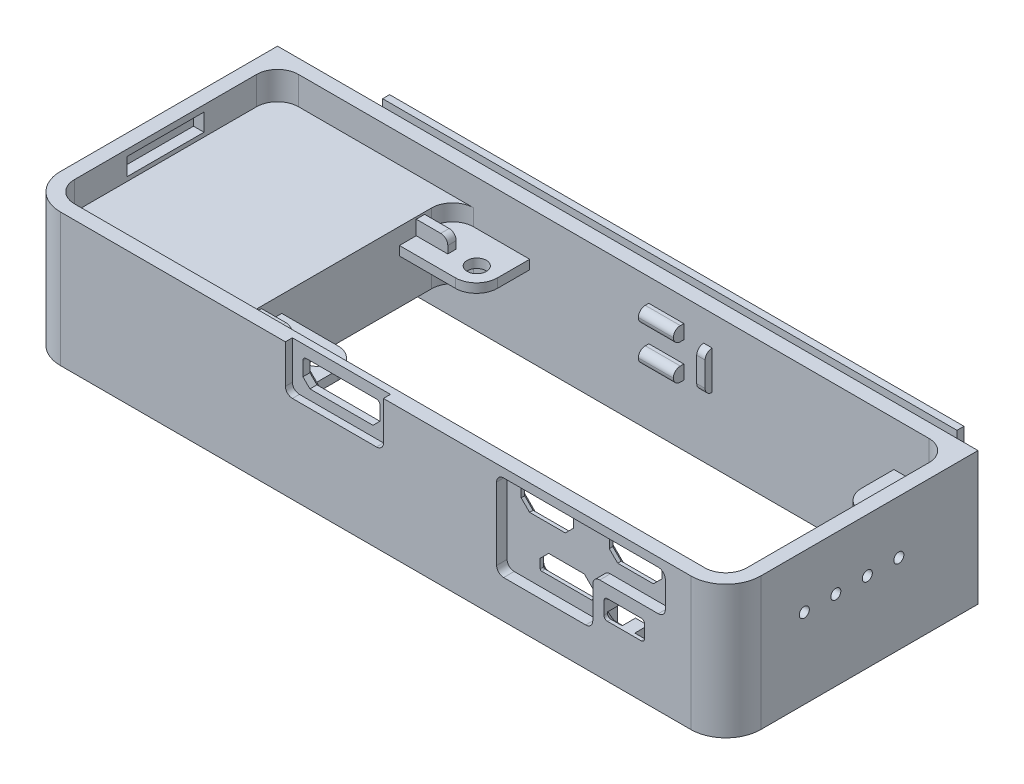
from build123d import *

# Parameters (mm, degrees)
EXTRUDE_1_DEPTH          = 7
EXTRUDE_1_DEPTH_BACK     = 12
CUT_EXTRUDE_2_DEPTH      = 45.635110658
CUT_EXTRUDE_2_DEPTH_BACK = 45.635110658
RIB_START                = -0.65
RIB_1_DEPTH              = 1.3
RIB_2_DEPTH              = 1.3
RIB_3_DEPTH              = 1.3
RIB_4_DEPTH              = 1.3
CUT_EXTRUDE_5_DEPTH      = 40
CUT_EXTRUDE_5_DEPTH_BACK = 40
SKETCH_18_R              = 1.375
SKETCH_41_W              = 14
SKETCH_41_H              = 6.5
CUT_EXTRUDE_14_DEPTH     = 1
EXTRUDE_14_DEPTH         = 0.5
CUT_EXTRUDE_18_DEPTH     = 1.5
SKETCH_50_W              = 7.5
SKETCH_50_H              = 2.7
CUT_EXTRUDE_19_DEPTH     = 2.9
SKETCH_51_W              = 5.8
SKETCH_51_H              = 2.8
CUT_EXTRUDE_20_DEPTH     = 2.4
FILLET_15_R              = 1
FILLET_16_R              = 1
FILLET_17_R              = 0.5
SKETCH_52_R              = 0.717792346
CUT_EXTRUDE_21_DEPTH     = 2
SKETCH_53_W              = 1.2
SKETCH_53_H              = 5.5
EXTRUDE_15_DEPTH         = 1
FILLET_20_R              = 1
SKETCH_55_W              = 1.2
SKETCH_55_H              = 5.5
EXTRUDE_17_DEPTH         = 1.4
SKETCH_54_W              = 1.2
SKETCH_54_H              = 5.5
EXTRUDE_18_DEPTH         = 4.5
FILLET_22_R              = 1
CHAMFER_2_SIZE           = 1.2
FILLET_23_R              = 0.2
SKETCH_58_W              = 11
SKETCH_58_H              = 2.5
CUT_EXTRUDE_23_DEPTH     = 1.4
CHAMFER_4_SIZE           = 1
SKETCH_59_W              = 11
SKETCH_59_H              = 2.5
CUT_EXTRUDE_24_DEPTH     = 1.4
CHAMFER_5_SIZE           = 1
SKETCH_60_W              = 7.5
SKETCH_60_H              = 5
CUT_EXTRUDE_25_DEPTH     = 0.5
EXTRUDE_20_DEPTH         = 0.9
EXTRUDE_20_DEPTH_BACK    = 0.5
SKETCH_56_W              = 0.6
SKETCH_56_H              = 1.5
SKETCH_56_W_2            = 1.8
SKETCH_56_H_2            = 0.767886541
SKETCH_56_W_3            = 1.5
SKETCH_56_H_3            = 1.54
CHAMFER_8_SIZE           = 1
SKETCH_63_W              = 1.2
SKETCH_63_H              = 5.5
EXTRUDE_21_DEPTH         = 4.5
FILLET_27_R              = 1
SKETCH_64_W              = 1.2
SKETCH_64_H              = 5.5
EXTRUDE_22_DEPTH         = 1.4
FILLET_28_R              = 1
SKETCH_65_W              = 1.2
SKETCH_65_H              = 5.5
EXTRUDE_23_DEPTH         = 0.9
CHAMFER_9_SIZE           = 0.5
FILLET_29_R              = 1
SKETCH_66_W              = 15
SKETCH_66_H              = 5
CUT_EXTRUDE_26_DEPTH     = 1.5
CHAMFER_10_SIZE          = 1
SKETCH_67_W              = 11
SKETCH_67_H              = 2.5
CUT_EXTRUDE_27_DEPTH     = 1.5
CHAMFER_11_SIZE          = 1
SKETCH_70_W              = 5
SKETCH_70_H              = 1.2
EXTRUDE_24_DEPTH         = 1.5
FILLET_31_R              = 1
SKETCH_71_W              = 5
SKETCH_71_H              = 2
EXTRUDE_25_DEPTH         = 1.5
FILLET_32_R              = 1
SKETCH_42_W              = 11
SKETCH_42_H              = 3.5
CUT_EXTRUDE_15_DEPTH     = 2.4
FILLET_33_R              = 1
SKETCH_74_W              = 16
SKETCH_74_H              = 7.4
EXTRUDE_26_DEPTH         = 0.5
CUT_EXTRUDE_29_REACH     = 56.445
SKETCH_46_W              = 11
SKETCH_46_H              = 3.5
CHAMFER_13_SIZE          = 1
FILLET_34_R              = 1
CHAMFER_14_SIZE          = 0.5
SKETCH_76_W              = 65
SKETCH_76_H              = 0.5
CUT_EXTRUDE_30_DEPTH     = 1.1
FILLET_35_R              = 1
FILLET_38_R              = 1.5
FILLET_39_R              = 0.5
ESQUISSE1_W              = 36
ESQUISSE1_H              = 19
BOSS_EXTRU_1_DEPTH       = 25
CONG_1_R                 = 5
ENL_V_MAT_EXTRU_1_DEPTH  = 4
ENL_V_START              = -5
ENL_V_MAT_EXTRU_2_DEPTH  = 5
ESQUISSE4_W              = 11
ESQUISSE4_H              = 2.5
ENL_V_MAT_EXTRU_3_DEPTH  = 1.5
CHANFREIN1_SIZE          = 1
ESQUISSE5_W              = 11
ESQUISSE5_H              = 2.5
ENL_V_MAT_EXTRU_4_DEPTH  = 1.5
CHANFREIN2_SIZE          = 1
ESQUISSE6_W              = 82
ESQUISSE6_H              = 7
BOSS_EXTRU_2_DEPTH       = 1
ESQUISSE7_W              = 82
ESQUISSE7_H              = 9
BOSS_EXTRU_3_DEPTH       = 1


with BuildPart() as part:
    # case 2 → 凸台-拉伸1 (new, two sides: drawn at the far end of the back side and taken through both)
    with BuildSketch(Plane(origin=(0, 0, 0), x_dir=(1, 0, 0), z_dir=(0, 1, 0)).offset(-EXTRUDE_1_DEPTH_BACK)):
        with BuildLine():
            Line((-39.042196447, 13), (-39.042196447, 18))
            Line((-39.042196447, 18), (-34.042196447, 18))
            Line((-34.042196447, 18), (30.957803553, 18))
            Line((30.957803553, 18), (35.957803553, 18))
            Line((35.957803553, 18), (35.957803553, 13))
            Line((35.957803553, 13), (35.957803553, -13))
            ThreePointArc((35.957803553, -13), (34.493337459, -16.535533906), (30.957803553, -18))
            Line((30.957803553, -18), (-34.042196447, -18))
            Line((-34.042196447, -18), (-39.042196447, -18))
            Line((-39.042196447, -18), (-39.042196447, -13))
            Line((-39.042196447, -13), (-39.042196447, 13))
        make_face()
    extrude(amount=EXTRUDE_1_DEPTH + EXTRUDE_1_DEPTH_BACK)

    # 草图13 → 切除-拉伸2 (cut, two sides: drawn at the far end of the back side and taken through both)
    with BuildSketch(Plane(origin=(0, 0, 0), x_dir=(1, 0, 0), z_dir=(0, 1, 0)).offset(-CUT_EXTRUDE_2_DEPTH_BACK)):
        with BuildLine():
            Line((-34.042196447, -16), (30.957803553, -16))
            ThreePointArc((30.957803553, -16), (33.079123896, -15.121320344), (33.957803553, -13))
            Line((33.957803553, -13), (33.957803553, 13))
            ThreePointArc((33.957803553, 13), (33.079123896, 15.121320344), (30.957803553, 16))
            Line((30.957803553, 16), (-34.042196447, 16))
            ThreePointArc((-34.042196447, 16), (-36.163516791, 15.121320344), (-37.042196447, 13))
            Line((-37.042196447, 13), (-37.042196447, -13))
            ThreePointArc((-37.042196447, -13), (-36.163516791, -15.121320344), (-34.042196447, -16))
        make_face()
    extrude(amount=CUT_EXTRUDE_2_DEPTH + CUT_EXTRUDE_2_DEPTH_BACK, mode=Mode.SUBTRACT)

    # 筋1: read off the stored shape, not the designer's step
    # 筋1 outline → 筋1 (add)
    with BuildSketch(Plane(origin=(0, 0, 0), x_dir=(1, 0, 0), z_dir=(0, 1, 0)).offset(RIB_START)):
        with BuildLine():
            Line((-37.042196447, 8.4), (-29.042196447, 8.4))
            ThreePointArc((-29.042196447, 8.4), (-26.920876103, 9.278679657), (-26.042196447, 11.4))
            Line((-26.042196447, 11.4), (-26.042196447, 16))
            Line((-26.042196447, 16), (-34.042196447, 16))
            ThreePointArc((-34.042196447, 16), (-36.163516791, 15.121320344), (-37.042196447, 13))
            Line((-37.042196447, 13), (-37.042196447, 8.4))
        make_face()
    extrude(amount=RIB_1_DEPTH)

    # 筋2: read off the stored shape, not the designer's step
    # 筋2 outline → 筋2 (add)
    with BuildSketch(Plane(origin=(0, 0, 0), x_dir=(1, 0, 0), z_dir=(0, 1, 0)).offset(RIB_START)):
        with BuildLine():
            Line((-34.042196447, -16), (-26.042196447, -16))
            Line((-26.042196447, -16), (-26.042196447, -11.4))
            ThreePointArc((-26.042196447, -11.4), (-26.920876103, -9.278679657), (-29.042196447, -8.4))
            Line((-29.042196447, -8.4), (-37.042196447, -8.4))
            Line((-37.042196447, -8.4), (-37.042196447, -13))
            ThreePointArc((-37.042196447, -13), (-36.163516791, -15.121320344), (-34.042196447, -16))
        make_face()
    extrude(amount=RIB_2_DEPTH)

    # 筋3: read off the stored shape, not the designer's step
    # 筋3 outline → 筋3 (add)
    with BuildSketch(Plane(origin=(0, 0, 0), x_dir=(1, 0, 0), z_dir=(0, 1, 0)).offset(RIB_START)):
        with BuildLine():
            ThreePointArc((25.957803553, 11.4), (26.836483209, 9.278679656), (28.957803553, 8.4))
            Line((28.957803553, 8.4), (33.957803553, 8.4))
            Line((33.957803553, 8.4), (33.957803553, 13))
            ThreePointArc((33.957803553, 13), (33.079123897, 15.121320343), (30.957803553, 16))
            Line((30.957803553, 16), (25.957803553, 16))
            Line((25.957803553, 16), (25.957803553, 11.4))
        make_face()
    extrude(amount=RIB_3_DEPTH)

    # 筋4: read off the stored shape, not the designer's step
    # 筋4 outline → 筋4 (add)
    with BuildSketch(Plane(origin=(0, 0, 0), x_dir=(1, 0, 0), z_dir=(0, 1, 0)).offset(RIB_START)):
        with BuildLine():
            Line((33.957803553, -13), (33.957803553, -8.4))
            Line((33.957803553, -8.4), (28.957803553, -8.4))
            ThreePointArc((28.957803553, -8.4), (26.836483209, -9.278679656), (25.957803553, -11.4))
            Line((25.957803553, -11.4), (25.957803553, -16))
            Line((25.957803553, -16), (30.957803553, -16))
            ThreePointArc((30.957803553, -16), (33.079123897, -15.121320343), (33.957803553, -13))
        make_face()
    extrude(amount=RIB_4_DEPTH)

    # 草图18 → 切除-拉伸5 (cut, two sides: drawn at the far end of the back side and taken through both)
    with BuildSketch(Plane(origin=(0, 0, 0), x_dir=(1, 0, 0), z_dir=(0, 1, 0)).offset(-CUT_EXTRUDE_5_DEPTH_BACK)):
        with Locations(Location((-29, 11.4, 0), (0, 0, 270))):
            Circle(SKETCH_18_R)
        with Locations(Location((-29, -11.5, 0), (0, 0, 270))):
            Circle(SKETCH_18_R)
        with Locations(Location((29, 11.4, 0), (0, 0, 270))):
            Circle(SKETCH_18_R)
        with Locations(Location((29, -11.5, 0), (0, 0, 270))):
            Circle(SKETCH_18_R)
    extrude(amount=CUT_EXTRUDE_5_DEPTH + CUT_EXTRUDE_5_DEPTH_BACK, mode=Mode.SUBTRACT)

    # 草图41 → 切除-拉伸14 (cut)
    with BuildSketch(Plane.XY.offset(18)):
        with Locations((-19.922149827, 3.75)):
            Rectangle(SKETCH_41_W, SKETCH_41_H)
    extrude(amount=-CUT_EXTRUDE_14_DEPTH, mode=Mode.SUBTRACT)

    # 草图48 → 凸台-拉伸14 (add)
    with BuildSketch(Plane(origin=(0, 0, 16), x_dir=(-1, 0, 0), z_dir=(0, 0, -1))):
        Polygon((-2.234862183, -7.567886541), (-2.234862183, 6.748192542), (-28.313738428, 6.748192542), (-28.313738428, -1), (-17.957803553, -1), (-17.957803553, -7.567886541), align=None)
    extrude(amount=EXTRUDE_14_DEPTH)

    # 草图49 → 切除-拉伸18 (cut)
    with BuildSketch(Plane.XY.offset(18)):
        Polygon((27.313738428, 5.748192542), (27.313738428, 0), (16.957803553, 0), (16.957803553, -6.567886541), (3.234862183, -6.567886541), (3.234862183, 5.748192542), align=None)
    extrude(amount=-CUT_EXTRUDE_18_DEPTH, mode=Mode.SUBTRACT)

    # 草图50 → 切除-拉伸19 (cut)
    with BuildSketch(Plane.XY.offset(18)):
        with Locations((21.563738428, 3.198192542)):
            Rectangle(SKETCH_50_W, SKETCH_50_H)
        with Locations((11.707803553, -3.217886541)):
            Rectangle(SKETCH_50_W, SKETCH_50_H)
        with Locations((8.984862183, 3.198192542)):
            Rectangle(SKETCH_50_W, SKETCH_50_H)
    extrude(amount=-CUT_EXTRUDE_19_DEPTH, mode=Mode.SUBTRACT)

    # 草图51 → 切除-拉伸20 (cut)
    with BuildSketch(Plane.XY.offset(18)):
        with Locations((21.457803553, -3.167886541)):
            Rectangle(SKETCH_51_W, SKETCH_51_H)
    extrude(amount=-CUT_EXTRUDE_20_DEPTH, mode=Mode.SUBTRACT)

    # 圆角15
    fillet_15_edges = [part.edges().sort_by_distance(p)[0] for p in [
        (3.234862183, 5.748192542, 17.25),
        (27.313738428, 5.748192542, 17.25),
        (27.313738428, 0, 17.25),
        (16.957803553, 0, 17.25),
        (16.957803553, -6.567886541, 17.25),
        (3.234862183, -6.567886541, 17.25),
    ]]
    fillet(fillet_15_edges, radius=FILLET_15_R)

    # 圆角16
    # the kernel refuses this fillet: 1 mm, written as the material it takes off along each edge
    with BuildSketch(Plane(origin=(2.234862183, -7.567886541, 16), x_dir=(0, 1, 0), z_dir=(0, 0, -1)), Plane(origin=(17.957803553, -7.567886541, 16), x_dir=(-1, 0, 0), z_dir=(0, 0, -1))) as fillet_16_piece_1:
        with BuildLine():
            CenterArc((FILLET_16_R, FILLET_16_R), FILLET_16_R, 180, 90)
            Line((0, FILLET_16_R), (-FILLET_16_R * 0.02, FILLET_16_R))
            Line((-FILLET_16_R * 0.02, FILLET_16_R), (-FILLET_16_R * 0.02, -FILLET_16_R * 0.02))
            Line((-FILLET_16_R * 0.02, -FILLET_16_R * 0.02), (FILLET_16_R, -FILLET_16_R * 0.02))
            Line((FILLET_16_R, -FILLET_16_R * 0.02), (FILLET_16_R, 0))
        make_face()
    extrude(amount=3, mode=Mode.SUBTRACT)
    with BuildSketch(Plane(origin=(28.313738428, -1, 16), x_dir=(0, 1, 0), z_dir=(0, 0, -1))) as fillet_16_piece_2:
        with BuildLine():
            CenterArc((1, -0.759934208), FILLET_16_R, 130.541601874, 49.458398126)
            Line((0, -0.759934208), (-0.02, -0.759934208))
            Line((-0.02, -0.759934208), (-0.02, 0))
            Line((-0.02, 0), (0, 0.02))
            ThreePointArc((0, 0.02), (0.175, 0.02), (0.337, 0.015198684))
            Line((0.337, 0.015198684), (0.35, 0))
        make_face()
    extrude(amount=2.399835519, mode=Mode.SUBTRACT)

    # 圆角17
    fillet_17_edges = [part.edges().sort_by_distance(p)[0] for p in [
        (18.557803553, -1.767886541, 17),
        (24.357803553, -1.767886541, 17),
        (24.357803553, -4.567886541, 17),
        (18.557803553, -4.567886541, 17),
    ]]
    fillet(fillet_17_edges, radius=FILLET_17_R)

    # 草图52 → 切除-拉伸21 (cut)
    with BuildSketch(Plane(origin=(35.957803553, 0, 0), x_dir=(0, 0, -1), z_dir=(1, 0, 0))):
        with Locations((-6.8, -0.597891307)):
            Circle(SKETCH_52_R)
        with Locations((-2.3, -0.597891307)):
            Circle(SKETCH_52_R)
        with Locations((2.2, -0.597891307)):
            Circle(SKETCH_52_R)
        with Locations((6.7, -0.597891307)):
            Circle(SKETCH_52_R)
    extrude(amount=-CUT_EXTRUDE_21_DEPTH, mode=Mode.SUBTRACT)

    # 草图53 → 凸台-拉伸15 (add)
    with BuildSketch(Plane.XY.offset(-16)):
        with Locations((-0.6, -0.05)):
            Rectangle(SKETCH_53_W, SKETCH_53_H)
    extrude(amount=EXTRUDE_15_DEPTH)

    # 圆角20
    fillet_20_edges = [part.edges().sort_by_distance(p)[0] for p in [
        (-0.6, -2.8, -15),
        (-0.6, 2.7, -15),
    ]]
    fillet(fillet_20_edges, radius=FILLET_20_R - 0.0001)  # a hair under: the kernel refuses the full size

    # 草图55 → 凸台-拉伸17 (add)
    with BuildSketch(Plane.ZY.offset(-33.957803553)):
        with Locations((-11.4, -0.05)):
            Rectangle(SKETCH_55_W, SKETCH_55_H)
    extrude(amount=EXTRUDE_17_DEPTH)

    # 草图54 → 凸台-拉伸18 (add)
    with BuildSketch(Plane(origin=(-37.042196447, 0, 0), x_dir=(0, 0, -1), z_dir=(1, 0, 0))):
        with Locations((11.4, -0.05)):
            Rectangle(SKETCH_54_W, SKETCH_54_H)
    extrude(amount=EXTRUDE_18_DEPTH)

    # 圆角22
    fillet_22_edges = [part.edges().sort_by_distance(p)[0] for p in [
        (32.557803553, -2.8, -11.4),
        (32.557803553, 2.7, -11.4),
        (-32.542196447, -2.8, -11.4),
        (-32.542196447, 2.7, -11.4),
    ]]
    fillet(fillet_22_edges, radius=FILLET_22_R)

    # 倒角2
    chamfer_2_edges = [part.edges().sort_by_distance(p)[0] for p in [
        (25.313738428, 1.848192542, 16),
        (17.813738428, 1.848192542, 16),
        (7.957803553, -1.867886541, 16),
        (15.457803553, -1.867886541, 16),
        (5.234862183, 1.848192542, 16),
        (12.734862183, 1.848192542, 16),
    ]]
    chamfer(chamfer_2_edges, length=CHAMFER_2_SIZE)

    # 圆角23
    fillet_23_edges = [part.edges().sort_by_distance(p)[0] for p in [
        (17.813738428, 4.548192542, 16),
        (25.313738428, 4.548192542, 16),
        (15.457803553, -4.567886541, 16),
        (7.957803553, -4.567886541, 16),
        (5.234862183, 4.548192542, 16),
        (12.734862183, 4.548192542, 16),
    ]]
    fillet(fillet_23_edges, radius=FILLET_23_R)

    # 草图58 → 切除-拉伸23 (cut)
    with BuildSketch(Plane.ZY.offset(-33.957803553)):
        with Locations((0, -9.85)):
            Rectangle(SKETCH_58_W, SKETCH_58_H)
    extrude(amount=-CUT_EXTRUDE_23_DEPTH, mode=Mode.SUBTRACT)

    # 倒角4
    chamfer_4_edges = [part.edges().sort_by_distance(p)[0] for p in [
        (35.357803553, -11.1, 0),
    ]]
    chamfer(chamfer_4_edges, length=CHAMFER_4_SIZE)

    # 草图59 → 切除-拉伸24 (cut)
    with BuildSketch(Plane(origin=(-37.042196447, 0, 0), x_dir=(0, 0, -1), z_dir=(1, 0, 0))):
        with Locations((2.5, 4.85)):
            Rectangle(SKETCH_59_W, SKETCH_59_H)
    extrude(amount=-CUT_EXTRUDE_24_DEPTH, mode=Mode.SUBTRACT)

    # 倒角5
    chamfer_5_edges = [part.edges().sort_by_distance(p)[0] for p in [
        (-38.442196447, 6.1, -2.5),
    ]]
    chamfer(chamfer_5_edges, length=CHAMFER_5_SIZE)

    # 草图60 → 切除-拉伸25 (cut)
    with BuildSketch(Plane(origin=(0, 0, 16), x_dir=(-1, 0, 0), z_dir=(0, 0, -1))):
        with Locations((-21.707803553, -3.5)):
            Rectangle(SKETCH_60_W, SKETCH_60_H)
    extrude(amount=-CUT_EXTRUDE_25_DEPTH, mode=Mode.SUBTRACT)

    # 草图56 → 凸台-拉伸20 (add, two sides: drawn at the far end of the back side and taken through both)
    with BuildSketch(Plane(origin=(0, 0, 16), x_dir=(-1, 0, 0), z_dir=(0, 0, -1)).offset(-EXTRUDE_20_DEPTH_BACK)):
        with Locations((-18.257803553, -3.15173139)):
            Rectangle(SKETCH_56_W, SKETCH_56_H)
        with Locations((-21.557803553, -1.383943271)):
            Rectangle(SKETCH_56_W_2, SKETCH_56_H_2)
        with Locations((-25.107803553, -3.15173139)):
            Rectangle(SKETCH_56_W_3, SKETCH_56_H)
        with Locations((-21.557803553, -5.337886541)):
            Rectangle(SKETCH_56_W_2, SKETCH_56_H_3)
    extrude(amount=EXTRUDE_20_DEPTH + EXTRUDE_20_DEPTH_BACK)

    # 倒角8
    # the kernel refuses this chamfer: 1 mm, written as the material it takes off along each edge
    with BuildSketch(Plane(origin=(19.057803553, -2.267886541, 16.5), x_dir=(-1, 0, 0), z_dir=(0, -1, 0))) as chamfer_8_piece_1_section:
        Polygon((0.5, -CHAMFER_8_SIZE), (0.5 + CHAMFER_8_SIZE, 0), (0.5, 0), align=None)
    chamfer_8_piece_1 = revolve(axis=Axis((19.057803553, -2.267886541, 16.5), (0, 0, -1)), revolution_arc=90, mode=Mode.PRIVATE)
    chamfer_8_piece_1 = split(chamfer_8_piece_1, bisect_by=Plane(origin=(17.957803553, -2.267886541, 16.5), z_dir=(1, 0, 0)), keep=Keep.TOP, mode=Mode.PRIVATE)
    chamfer_8_piece_1 = split(chamfer_8_piece_1, bisect_by=Plane(origin=(19.057803553, -1, 16.5), z_dir=(0, -1, 0)), keep=Keep.TOP, mode=Mode.PRIVATE)
    add(chamfer_8_piece_1, mode=Mode.SUBTRACT)
    with BuildSketch(Plane(origin=(24.357803553, -2.267886541, 16.5), x_dir=(0, 0, 1), z_dir=(0, -1, 0))) as chamfer_8_piece_2:
        Polygon((CHAMFER_8_SIZE, 0), (0, -CHAMFER_8_SIZE), (0, 0), align=None)
    extrude(amount=0.133844849, mode=Mode.SUBTRACT)
    with BuildSketch(Plane(origin=(23.857803553, -4.067886541, 16.5), x_dir=(1, 0, 0), z_dir=(0, 1, 0))) as chamfer_8_piece_3:
        Polygon((0.5, -CHAMFER_8_SIZE), (0.5 + CHAMFER_8_SIZE, 0), (0.5, 0), align=None)
    revolve(axis=Axis((23.857803553, -4.067886541, 16.5), (0, 0, -1)), revolution_arc=90, mode=Mode.SUBTRACT)
    with BuildSketch(Plane(origin=(23.857803553, -4.567886541, 16.5), x_dir=(0, 0, 1), z_dir=(-1, 0, 0))) as chamfer_8_piece_4:
        Polygon((CHAMFER_8_SIZE, 0), (0, -CHAMFER_8_SIZE), (0, 0), align=None)
    extrude(amount=1.4, mode=Mode.SUBTRACT)
    with BuildSketch(Plane(origin=(23.857803553, -4.567886541, 16.5), x_dir=(0, 0, 1), z_dir=(-1, 0, 0))) as chamfer_8_piece_5_section:
        Polygon((CHAMFER_8_SIZE, 0), (0, -CHAMFER_8_SIZE), (0, 0), align=None)
    chamfer_8_piece_5 = extrude(amount=3.971682988, mode=Mode.PRIVATE)
    chamfer_8_piece_5 = split(chamfer_8_piece_5, bisect_by=Plane(origin=(20.657803553, -4.567886541, 16.5), z_dir=(-1, 0, 0)), keep=Keep.TOP, mode=Mode.PRIVATE)
    add(chamfer_8_piece_5, mode=Mode.SUBTRACT)
    with BuildSketch(Plane(origin=(19.057803553, -4.067886541, 16.5), x_dir=(0, -1, 0), z_dir=(1, 0, 0))) as chamfer_8_piece_6_section:
        Polygon((0.5, -CHAMFER_8_SIZE), (0.5 + CHAMFER_8_SIZE, 0), (0.5, 0), align=None)
    chamfer_8_piece_6 = revolve(axis=Axis((19.057803553, -4.067886541, 16.5), (0, 0, -1)), revolution_arc=90, mode=Mode.PRIVATE)
    chamfer_8_piece_6 = split(chamfer_8_piece_6, bisect_by=Plane(origin=(17.957803553, -4.067886541, 16.5), z_dir=(1, 0, 0)), keep=Keep.TOP, mode=Mode.PRIVATE)
    add(chamfer_8_piece_6, mode=Mode.SUBTRACT)
    with BuildSketch(Plane(origin=(18.557803553, -4.067886541, 16.5), x_dir=(0, 0, 1), z_dir=(0, 1, 0))) as chamfer_8_piece_7_section:
        Polygon((CHAMFER_8_SIZE, 0), (0, -CHAMFER_8_SIZE), (0, 0), align=None)
    chamfer_8_piece_7 = extrude(amount=0.166155151, mode=Mode.PRIVATE)
    chamfer_8_piece_7 = split(chamfer_8_piece_7, bisect_by=Plane(origin=(17.957803553, -4.067886541, 16.5), z_dir=(1, 0, 0)), keep=Keep.TOP, mode=Mode.PRIVATE)
    add(chamfer_8_piece_7, mode=Mode.SUBTRACT)
    with BuildSketch(Plane(origin=(19.057803553, -1.767886541, 16.5), x_dir=(0, 0, 1), z_dir=(1, 0, 0))) as chamfer_8_piece_8_section:
        Polygon((CHAMFER_8_SIZE, 0), (0, -CHAMFER_8_SIZE), (0, 0), align=None)
    chamfer_8_piece_8 = extrude(amount=1.6, mode=Mode.PRIVATE)
    chamfer_8_piece_8 = split(chamfer_8_piece_8, bisect_by=Plane(origin=(19.057803553, -1, 16.5), z_dir=(0, -1, 0)), keep=Keep.TOP, mode=Mode.PRIVATE)
    add(chamfer_8_piece_8, mode=Mode.SUBTRACT)
    with BuildSketch(Plane(origin=(19.057803553, -1.767886541, 16.5), x_dir=(0, 0, 1), z_dir=(1, 0, 0))) as chamfer_8_piece_9_section:
        Polygon((CHAMFER_8_SIZE, 0), (0, -CHAMFER_8_SIZE), (0, 0), align=None)
    chamfer_8_piece_9 = extrude(amount=4.171682988, mode=Mode.PRIVATE)
    chamfer_8_piece_9 = split(chamfer_8_piece_9, bisect_by=Plane(origin=(19.057803553, -1, 16.5), z_dir=(0, -1, 0)), keep=Keep.TOP, mode=Mode.PRIVATE)
    chamfer_8_piece_9 = split(chamfer_8_piece_9, bisect_by=Plane(origin=(22.457803553, -1.767886541, 16.5), z_dir=(1, 0, 0)), keep=Keep.TOP, mode=Mode.PRIVATE)
    add(chamfer_8_piece_9, mode=Mode.SUBTRACT)
    with BuildSketch(Plane(origin=(23.857803553, -2.267886541, 16.5), x_dir=(0, 1, 0), z_dir=(-1, 0, 0))) as chamfer_8_piece_10_section:
        Polygon((0.5, -CHAMFER_8_SIZE), (0.5 + CHAMFER_8_SIZE, 0), (0.5, 0), align=None)
    chamfer_8_piece_10 = revolve(axis=Axis((23.857803553, -2.267886541, 16.5), (0, 0, -1)), revolution_arc=90, mode=Mode.PRIVATE)
    chamfer_8_piece_10 = split(chamfer_8_piece_10, bisect_by=Plane(origin=(23.857803553, -1, 16.5), z_dir=(0, -1, 0)), keep=Keep.TOP, mode=Mode.PRIVATE)
    add(chamfer_8_piece_10, mode=Mode.SUBTRACT)
    with BuildSketch(Plane(origin=(19.886120565, -1.767886541, 16.5), x_dir=(0, 0, 1), z_dir=(1, 0, 0))) as chamfer_8_piece_11_section:
        Polygon((CHAMFER_8_SIZE, 0), (0, -CHAMFER_8_SIZE), (0, 0), align=None)
    chamfer_8_piece_11 = extrude(amount=3.971682988, mode=Mode.PRIVATE)
    chamfer_8_piece_11 = split(chamfer_8_piece_11, bisect_by=Plane(origin=(19.886120565, -1, 16.5), z_dir=(0, -1, 0)), keep=Keep.TOP, mode=Mode.PRIVATE)
    chamfer_8_piece_11 = split(chamfer_8_piece_11, bisect_by=Plane(origin=(20.657803553, -1.767886541, 16.5), z_dir=(-1, 0, 0)), keep=Keep.TOP, mode=Mode.PRIVATE)
    add(chamfer_8_piece_11, mode=Mode.SUBTRACT)
    with BuildSketch(Plane(origin=(22.457803553, -1.767886541, 16.5), x_dir=(0, 0, 1), z_dir=(1, 0, 0))) as chamfer_8_piece_12_section:
        Polygon((CHAMFER_8_SIZE, 0), (0, -CHAMFER_8_SIZE), (0, 0), align=None)
    chamfer_8_piece_12 = extrude(amount=1.4, mode=Mode.PRIVATE)
    chamfer_8_piece_12 = split(chamfer_8_piece_12, bisect_by=Plane(origin=(22.457803553, -1, 16.5), z_dir=(0, -1, 0)), keep=Keep.TOP, mode=Mode.PRIVATE)
    add(chamfer_8_piece_12, mode=Mode.SUBTRACT)
    with BuildSketch(Plane(origin=(18.557803553, -2.40173139, 16.5), x_dir=(0, 0, 1), z_dir=(0, 1, 0))) as chamfer_8_piece_13_section:
        Polygon((CHAMFER_8_SIZE, 0), (0, -CHAMFER_8_SIZE), (0, 0), align=None)
    chamfer_8_piece_13 = extrude(amount=0.133844849, mode=Mode.PRIVATE)
    chamfer_8_piece_13 = split(chamfer_8_piece_13, bisect_by=Plane(origin=(17.957803553, -2.40173139, 16.5), z_dir=(1, 0, 0)), keep=Keep.TOP, mode=Mode.PRIVATE)
    add(chamfer_8_piece_13, mode=Mode.SUBTRACT)
    with BuildSketch(Plane(origin=(24.357803553, -3.90173139, 16.5), x_dir=(0, 0, 1), z_dir=(0, -1, 0))) as chamfer_8_piece_14:
        Polygon((CHAMFER_8_SIZE, 0), (0, -CHAMFER_8_SIZE), (0, 0), align=None)
    extrude(amount=0.166155151, mode=Mode.SUBTRACT)
    with BuildSketch(Plane(origin=(23.229486541, -4.567886541, 16.5), x_dir=(0, 0, 1), z_dir=(-1, 0, 0))) as chamfer_8_piece_15_section:
        Polygon((CHAMFER_8_SIZE, 0), (0, -CHAMFER_8_SIZE), (0, 0), align=None)
    chamfer_8_piece_15 = extrude(amount=4.171682988, mode=Mode.PRIVATE)
    chamfer_8_piece_15 = split(chamfer_8_piece_15, bisect_by=Plane(origin=(22.457803553, -4.567886541, 16.5), z_dir=(1, 0, 0)), keep=Keep.TOP, mode=Mode.PRIVATE)
    add(chamfer_8_piece_15, mode=Mode.SUBTRACT)
    with BuildSketch(Plane(origin=(20.657803553, -4.567886541, 16.5), x_dir=(0, 0, 1), z_dir=(-1, 0, 0))) as chamfer_8_piece_16:
        Polygon((CHAMFER_8_SIZE, 0), (0, -CHAMFER_8_SIZE), (0, 0), align=None)
    extrude(amount=1.6, mode=Mode.SUBTRACT)

    # 草图63 → 凸台-拉伸21 (add)
    with BuildSketch(Plane(origin=(-37.042196447, 0, 0), x_dir=(0, 0, -1), z_dir=(1, 0, 0))):
        with Locations((-11.9, -0.05)):
            Rectangle(SKETCH_63_W, SKETCH_63_H)
    extrude(amount=EXTRUDE_21_DEPTH)

    # 圆角27
    fillet_27_edges = [part.edges().sort_by_distance(p)[0] for p in [
        (-32.542196447, -2.8, 11.9),
        (-32.542196447, 2.7, 11.9),
    ]]
    fillet(fillet_27_edges, radius=FILLET_27_R)

    # 草图64 → 凸台-拉伸22 (add)
    with BuildSketch(Plane.ZY.offset(-33.957803553)):
        with Locations((11.9, -0.05)):
            Rectangle(SKETCH_64_W, SKETCH_64_H)
    extrude(amount=EXTRUDE_22_DEPTH)

    # 圆角28
    fillet_28_edges = [part.edges().sort_by_distance(p)[0] for p in [
        (32.557803553, -2.8, 11.9),
        (32.557803553, 2.7, 11.9),
    ]]
    fillet(fillet_28_edges, radius=FILLET_28_R)

    # 草图65 → 凸台-拉伸23 (add)
    with BuildSketch(Plane(origin=(0, 0, 16), x_dir=(-1, 0, 0), z_dir=(0, 0, -1))):
        with Locations((0.6, -0.05)):
            Rectangle(SKETCH_65_W, SKETCH_65_H)
    extrude(amount=EXTRUDE_23_DEPTH)

    # 倒角9
    chamfer_9_edges = [part.edges().sort_by_distance(p)[0] for p in [
        (21.557803553, -1.767886541, 15.1),
        (18.557803553, -3.15173139, 15.1),
        (24.357803553, -3.15173139, 15.1),
        (21.557803553, -4.567886541, 15.1),
    ]]
    chamfer(chamfer_9_edges, length=CHAMFER_9_SIZE)

    # 圆角29
    # the kernel refuses this fillet: 1 mm, written as the material it takes off along each edge
    with BuildSketch(Plane(origin=(0, -2.8, 15.1), x_dir=(0, 0, 1), z_dir=(-1, 0, 0)), Plane(origin=(-3.687468593, 2.7, 15.1), x_dir=(0, 0, 1), z_dir=(1, 0, 0))) as fillet_29_piece_1:
        with BuildLine():
            CenterArc((1, 0.994987437), FILLET_29_R, 180, 84.260829523)
            Line((0, 0.994987437), (0, 0))
            Line((0, 0), (0.9, 0))
        make_face()
    extrude(amount=3.687468593, mode=Mode.SUBTRACT)

    # 草图66 → 切除-拉伸26 (cut)
    with BuildSketch(Plane.ZY.offset(-33.957803553)):
        with Locations((0, 3.6)):
            Rectangle(SKETCH_66_W, SKETCH_66_H)
    extrude(amount=-CUT_EXTRUDE_26_DEPTH, mode=Mode.SUBTRACT)

    # 倒角10
    chamfer_10_edges = [part.edges().sort_by_distance(p)[0] for p in [
        (35.457803553, 6.1, 0),
    ]]
    chamfer(chamfer_10_edges, length=CHAMFER_10_SIZE)

    # 草图67 → 切除-拉伸27 (cut)
    with BuildSketch(Plane(origin=(-37.042196447, 0, 0), x_dir=(0, 0, -1), z_dir=(1, 0, 0))):
        with Locations((0, -9.85)):
            Rectangle(SKETCH_67_W, SKETCH_67_H)
    extrude(amount=-CUT_EXTRUDE_27_DEPTH, mode=Mode.SUBTRACT)

    # 倒角11
    chamfer_11_edges = [part.edges().sort_by_distance(p)[0] for p in [
        (-38.542196447, -11.1, 0),
    ]]
    chamfer(chamfer_11_edges, length=CHAMFER_11_SIZE)

    # 草图70 → 凸台-拉伸24 (add)
    with BuildSketch(Plane(origin=(0, 0, 16), x_dir=(-1, 0, 0), z_dir=(0, 0, -1))):
        with Locations((6.542196447, 2.45)):
            Rectangle(SKETCH_70_W, SKETCH_70_H)
        with Locations((6.542196447, -2.45)):
            Rectangle(SKETCH_70_W, SKETCH_70_H)
    extrude(amount=EXTRUDE_24_DEPTH)

    # 圆角31
    fillet_31_edges = [part.edges().sort_by_distance(p)[0] for p in [
        (-6.542196447, 3.05, 14.5),
        (-6.542196447, -3.05, 14.5),
    ]]
    fillet(fillet_31_edges, radius=FILLET_31_R)

    # 草图71 → 凸台-拉伸25 (add)
    with BuildSketch(Plane.XY.offset(-16)):
        with Locations((-6.537335394, 2.7)):
            Rectangle(SKETCH_71_W, SKETCH_71_H)
        with Locations((-6.537335394, -2.3)):
            Rectangle(SKETCH_71_W, SKETCH_71_H)
    extrude(amount=EXTRUDE_25_DEPTH)

    # 圆角32
    fillet_32_edges = [part.edges().sort_by_distance(p)[0] for p in [
        (-6.537335394, -3.3, -14.5),
        (-6.537335394, -1.3, -14.5),
        (-6.537335394, 1.7, -14.5),
        (-6.537335394, 3.7, -14.5),
    ]]
    fillet(fillet_32_edges, radius=FILLET_32_R - 0.0001)  # a hair under: the kernel refuses the full size

    # 草图42 → 切除-拉伸15 (cut)
    with BuildSketch(Plane.XY.offset(18)):
        with Locations((-19.922149827, 3.68)):
            Rectangle(SKETCH_42_W, SKETCH_42_H)
    extrude(amount=-CUT_EXTRUDE_15_DEPTH, mode=Mode.SUBTRACT)

    # 圆角33
    fillet_33_edges = [part.edges().sort_by_distance(p)[0] for p in [
        (-26.922149827, 0.5, 17.5),
        (-12.922149827, 0.5, 17.5),
    ]]
    fillet(fillet_33_edges, radius=FILLET_33_R)

    # 草图74 → 凸台-拉伸26 (add)
    with BuildSketch(Plane(origin=(0, 0, 16), x_dir=(-1, 0, 0), z_dir=(0, 0, -1))):
        with Locations((20.042196447, 3.3)):
            Rectangle(SKETCH_74_W, SKETCH_74_H)
    extrude(amount=EXTRUDE_26_DEPTH)

    # 草图46 → 切除-拉伸29 (cut, up to next)
    with BuildSketch(Plane.XY.offset(18), mode=Mode.PRIVATE) as cut_extrude_29_sk1:
        with Locations((-19.922149827, 3.68)):
            Rectangle(SKETCH_46_W, SKETCH_46_H)
    cut_extrude_29_tool1 = extrude(cut_extrude_29_sk1.sketch, amount=-CUT_EXTRUDE_29_REACH, mode=Mode.PRIVATE) & part.part
    add(cut_extrude_29_tool1.solids().sort_by_distance((-19.92215, 3.68, 18))[0], mode=Mode.SUBTRACT)

    # 倒角13
    chamfer_13_edges = [part.edges().sort_by_distance(p)[0] for p in [
        (-25.422149827, 1.93, 16.25),
        (-14.422149827, 1.93, 16.25),
    ]]
    chamfer(chamfer_13_edges, length=CHAMFER_13_SIZE)

    # 圆角34
    fillet_34_edges = [part.edges().sort_by_distance(p)[0] for p in [
        (-12.042196447, -0.4, 15.75),
    ]]
    fillet(fillet_34_edges, radius=FILLET_34_R)

    # 倒角14
    chamfer_14_edges = [part.edges().sort_by_distance(p)[0] for p in [
        (-19.922149827, 5.43, 15.5),
        (-25.422149827, 4.18, 15.5),
        (-14.422149827, 4.18, 15.5),
        (-19.922149827, 1.93, 15.5),
        (-14.922149827, 2.43, 15.5),
        (-24.922149827, 2.43, 15.5),
        (11.707803553, -1.867886541, 15.5),
        (15.457803553, -3.717886541, 15.5),
        (8.984862183, 1.848192542, 15.5),
        (5.234862183, 3.698192542, 15.5),
        (21.563738428, 1.848192542, 15.5),
        (17.813738428, 3.698192542, 15.5),
        (14.857803553, -2.467886541, 15.5),
        (8.557803553, -2.467886541, 15.5),
        (5.834862183, 2.448192542, 15.5),
        (12.134862183, 2.448192542, 15.5),
        (24.713738428, 2.448192542, 15.5),
        (18.413738428, 2.448192542, 15.5),
        (8.984862183, 4.548192542, 15.5),
        (12.734862183, 3.698192542, 15.5),
        (21.563738428, 4.548192542, 15.5),
        (25.313738428, 3.698192542, 15.5),
        (11.707803553, -4.567886541, 15.5),
        (7.957803553, -3.717886541, 15.5),
        (5.293440827, 4.489613898, 15.5),
        (12.676283539, 4.489613898, 15.5),
        (17.872317072, 4.489613898, 15.5),
        (25.255159784, 4.489613898, 15.5),
        (15.399224909, -4.509307897, 15.5),
        (8.016382197, -4.509307897, 15.5),
    ]]
    chamfer(chamfer_14_edges, length=CHAMFER_14_SIZE)

    # 草图76 → 切除-拉伸30 (cut)
    with BuildSketch(Plane(origin=(0, 7, 0), x_dir=(1, 0, 0), z_dir=(0, 1, 0))):
        with Locations((-1.542196447, -15.75)):
            Rectangle(SKETCH_76_W, SKETCH_76_H)
    extrude(amount=-CUT_EXTRUDE_30_DEPTH, mode=Mode.SUBTRACT)

    # 圆角35
    fillet_35_edges = [part.edges().sort_by_distance(p)[0] for p in [
        (2.234862183, 5.9, 15.75),
        (28.313738428, 5.9, 15.75),
        (-12.042196447, 5.9, 15.75),
        (-28.042196447, 5.9, 15.75),
    ]]
    fillet(fillet_35_edges, radius=FILLET_35_R)

    # 圆角38
    fillet_38_edges = [part.edges().sort_by_distance(p)[0] for p in [
        (35.457803553, 3.1, 7.5),
        (35.457803553, 3.1, -7.5),
        (35.457803553, 1.1, 0),
    ]]
    fillet(fillet_38_edges, radius=FILLET_38_R - 0.0001)  # a hair under: the kernel refuses the full size

    # 圆角39
    fillet_39_edges = [part.edges().sort_by_distance(p)[0] for p in [
        (-14.422149827, 5.43, 16.5),
        (-25.422149827, 5.43, 16.5),
    ]]
    fillet(fillet_39_edges, radius=FILLET_39_R)

    # Esquisse1 → Boss.-Extru.1 (add)
    with BuildSketch(Plane.ZY.offset(39.042196447)):
        with Locations((0, -2.5)):
            Rectangle(ESQUISSE1_W, ESQUISSE1_H)
    extrude(amount=BOSS_EXTRU_1_DEPTH)

    # Congé1
    cong_1_edges = [part.edges().sort_by_distance(p)[0] for p in [
        (-64.042196447, -2.5, 18),
    ]]
    fillet(cong_1_edges, radius=CONG_1_R)

    # Esquisse2 → Enlèv. mat.-Extru.1 (cut)
    with BuildSketch(Plane(origin=(0, 7, 0), x_dir=(1, 0, 0), z_dir=(0, 1, 0))):
        with BuildLine():
            Line((-34.042196447, 16), (-59.042196447, 16))
            ThreePointArc((-59.042196447, 16), (-61.163516791, 15.121320344), (-62.042196447, 13))
            Line((-62.042196447, 13), (-62.042196447, -13))
            ThreePointArc((-62.042196447, -13), (-61.163516791, -15.121320344), (-59.042196447, -16))
            Line((-59.042196447, -16), (-34.042196447, -16))
            Line((-34.042196447, -16), (-34.042196447, 16))
        make_face()
    extrude(amount=-ENL_V_MAT_EXTRU_1_DEPTH, mode=Mode.SUBTRACT)

    # Esquisse3 → Enlèv. mat.-Extru.2 (cut)
    with BuildSketch(Plane(origin=(0, -12, 0), x_dir=(-1, 0, 0), z_dir=(0, -1, 0)).offset(ENL_V_START)):
        with BuildLine():
            Line((34.042196447, 16), (59.042196447, 16))
            ThreePointArc((59.042196447, 16), (61.163516791, 15.121320344), (62.042196447, 13))
            Line((62.042196447, 13), (62.042196447, -13))
            ThreePointArc((62.042196447, -13), (61.163516791, -15.121320344), (59.042196447, -16))
            Line((59.042196447, -16), (34.042196447, -16))
            Line((34.042196447, -16), (34.042196447, 16))
        make_face()
    extrude(amount=ENL_V_MAT_EXTRU_2_DEPTH, mode=Mode.SUBTRACT)

    # Esquisse4 → Enlèv. mat.-Extru.3 (cut)
    with BuildSketch(Plane(origin=(-62.042196447, 0, 0), x_dir=(0, 0, -1), z_dir=(1, 0, 0))):
        with Locations((0, 4.85)):
            Rectangle(ESQUISSE4_W, ESQUISSE4_H)
    extrude(amount=-ENL_V_MAT_EXTRU_3_DEPTH, mode=Mode.SUBTRACT)

    # Chanfrein1
    chanfrein1_edges = [part.edges().sort_by_distance(p)[0] for p in [
        (-63.542196447, 6.1, 0),
    ]]
    chamfer(chanfrein1_edges, length=CHANFREIN1_SIZE)

    # Esquisse5 → Enlèv. mat.-Extru.4 (cut)
    with BuildSketch(Plane(origin=(-62.042196447, 0, 0), x_dir=(0, 0, -1), z_dir=(1, 0, 0))):
        with Locations((0, -9.85)):
            Rectangle(ESQUISSE5_W, ESQUISSE5_H)
    extrude(amount=-ENL_V_MAT_EXTRU_4_DEPTH, mode=Mode.SUBTRACT)

    # Chanfrein2
    chanfrein2_edges = [part.edges().sort_by_distance(p)[0] for p in [
        (-63.542196447, -11.1, 0),
    ]]
    chamfer(chanfrein2_edges, length=CHANFREIN2_SIZE)

    # Esquisse6 → Boss.-Extru.2 (add)
    with BuildSketch(Plane(origin=(0, 0, -18), x_dir=(-1, 0, 0), z_dir=(0, 0, -1))):
        with Locations((9.042196447, 2.5)):
            Rectangle(ESQUISSE6_W, ESQUISSE6_H)
    extrude(amount=BOSS_EXTRU_2_DEPTH)

    # Esquisse7 → Boss.-Extru.3 (add)
    with BuildSketch(Plane(origin=(0, 0, -19), x_dir=(-1, 0, 0), z_dir=(0, 0, -1))):
        with Locations((9.042196447, 2.5)):
            Rectangle(ESQUISSE7_W, ESQUISSE7_H)
    extrude(amount=BOSS_EXTRU_3_DEPTH)


solid = part.part
